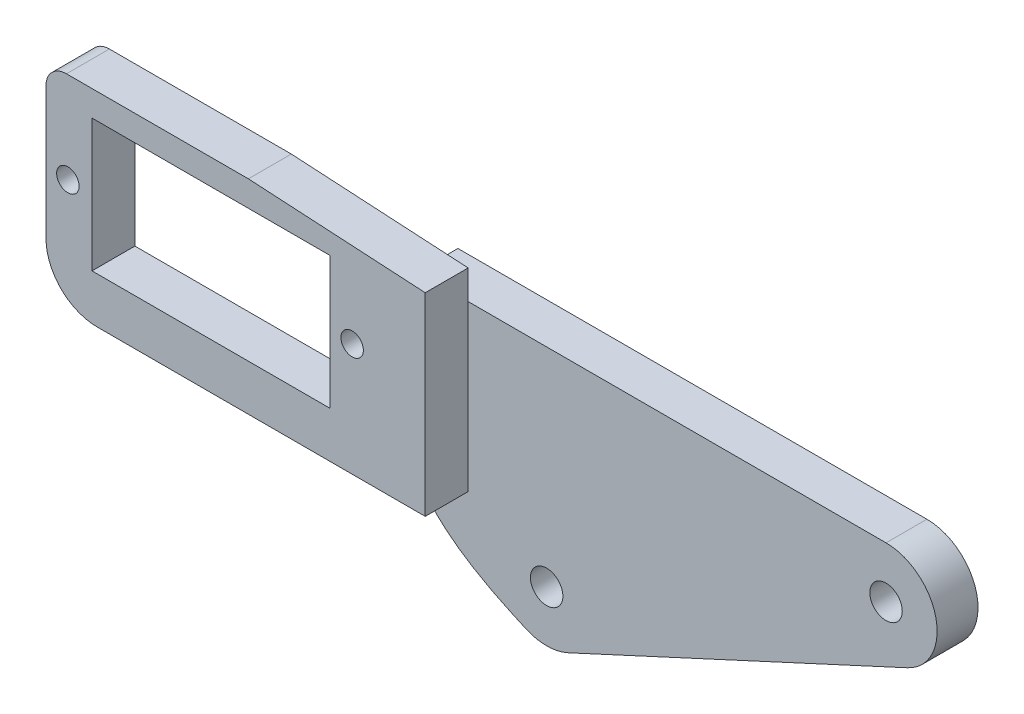
from build123d import *

# Parameters (mm, degrees)
BOSS_EXTRUDE1_DEPTH      = 2.5
BOSS_EXTRUDE1_DEPTH_BACK = 1.5
SKETCH2_R                = 1.5875
CUT_EXTRUDE1_DEPTH       = 44.756449915
CUT_EXTRUDE3_DEPTH       = 59.296841331
SKETCH4_W                = 4.2
SKETCH4_H                = 22.2
BOSS_EXTRUDE2_DEPTH      = 32.1
SKETCH6_W                = 23.3
SKETCH6_H                = 12.95
CUT_EXTRUDE4_DEPTH       = 4.2
SKETCH7_W                = 4.2
SKETCH7_H                = 22.2
BOSS_EXTRUDE3_DEPTH      = 5
CUT_EXTRUDE5_DEPTH       = 3.7
FILLET1_R                = 5
F_2_0MM_DOWEL_HOLE1_D    = 2.2
SKETCH12_W               = 37.1
SKETCH12_H               = 2.25
CUT_EXTRUDE6_DEPTH       = 4.2
FILLET3_R                = 2
CUT_EXTRUDE7_REACH       = 51.552


with BuildPart() as part:
    # Sketch1 → Boss-Extrude1 (new, two sides: drawn at the far end of the back side and taken through both)
    with BuildSketch(Plane.XY.offset(-BOSS_EXTRUDE1_DEPTH_BACK)):
        with BuildLine():
            Line((-33.54, 5), (33.54, 5))
            ThreePointArc((33.54, 5), (38.423518139, 1.072963462), (35.635934611, -4.539499764))
            Line((35.635934611, -4.539499764), (2.434033336, -19.869165506))
            ThreePointArc((2.434033336, -19.869165506), (0.357155817, -20.329629424), (-1.723171376, -19.885010467))
            Line((-1.723171376, -19.885010467), (-35.601270101, -4.555344726))
            ThreePointArc((-35.601270101, -4.555344726), (-38.42757218, 1.054342537), (-33.54, 5))
        make_face()
    extrude(amount=BOSS_EXTRUDE1_DEPTH + BOSS_EXTRUDE1_DEPTH_BACK)

    # Sketch2 → Cut-Extrude1 (cut, through all)
    with BuildSketch(Plane.XY.offset(2.5)):
        with Locations((-33.54, 0)):
            Circle(SKETCH2_R)
        with Locations((33.54, 0)):
            Circle(SKETCH2_R)
        with Locations((0.338098725, -15.329665742)):
            Circle(SKETCH2_R)
    extrude(amount=-CUT_EXTRUDE1_DEPTH, mode=Mode.SUBTRACT)

    # Sketch3 → Cut-Extrude3 (cut, through all)
    with BuildSketch(Plane.ZY.offset(16.04)):
        Polygon((-1.5, -4.555344726), (-1.5, -19.885010467), (2.5, -19.885010467), (2.5, -4.555344726), (2.5, 5), (-1.5, 5), align=None)
    extrude(amount=CUT_EXTRUDE3_DEPTH, mode=Mode.SUBTRACT)

    # Sketch4 → Boss-Extrude2 (add)
    with BuildSketch(Plane.ZY.offset(12.34)):
        with Locations((4.6, 0)):
            Rectangle(SKETCH4_W, SKETCH4_H)
    extrude(amount=BOSS_EXTRUDE2_DEPTH)

    # Sketch6 → Cut-Extrude4 (cut)
    with BuildSketch(Plane(origin=(0, 0, 2.5), x_dir=(-1, 0, 0), z_dir=(0, 0, -1))):
        with Locations((28.29, -0.125)):
            Rectangle(SKETCH6_W, SKETCH6_H)
    extrude(amount=-CUT_EXTRUDE4_DEPTH, mode=Mode.SUBTRACT)

    # Sketch7 → Boss-Extrude3 (add)
    with BuildSketch(Plane(origin=(-12.34, 0, 0), x_dir=(0, 0, -1), z_dir=(1, 0, 0))):
        with Locations((-4.6, 0)):
            Rectangle(SKETCH7_W, SKETCH7_H)
    extrude(amount=BOSS_EXTRUDE3_DEPTH)

    # Sketch8 → Cut-Extrude5 (cut)
    with BuildSketch(Plane.ZY.offset(12.34)):
        Polygon((2.5, -13.406719018), (2.5, -11.1), (2.5, 5), (-1.5, 5), (-1.5, -13.406719018), (-1.5, -19.885010467), (2.5, -19.885010467), align=None)
    extrude(amount=CUT_EXTRUDE5_DEPTH, mode=Mode.SUBTRACT)

    # Fillet1
    fillet1_edges = [part.edges().sort_by_distance(p)[0] for p in [
        (-44.44, -11.1, 4.6),
    ]]
    fillet(fillet1_edges, radius=FILLET1_R)

    # Fillet2
    # a fillet whose section is not a circle: 13, 9 mm, written as the material it takes off along each edge
    with BuildSketch(Plane(origin=(-12.34, -15.080950022, 2.5), x_dir=(0, 1, 0), z_dir=(0, 0, -1))) as fillet2_piece_1:
        with BuildLine():
            Bezier((3.996072697, 0), (0, 0), (-4.203547809, 9.289713818), weights=[1, 0.840313638, 1])
            Line((-4.203547809, 9.289713818), (0, 0))
            Line((0, 0), (3.996072697, 0))
        make_face()
    extrude(amount=29.491248131, mode=Mode.SUBTRACT)

    # Ø2.0mm Dowel Hole1 (through all)
    with Locations(Plane.XY.offset(6.7)):
        with Locations((-42.3, -0.06), (-14.49, -0.06)):
            Hole(F_2_0MM_DOWEL_HOLE1_D / 2)

    # Sketch12 → Cut-Extrude6 (cut)
    with BuildSketch(Plane.XY.offset(6.7)):
        with Locations((-25.89, 9.975)):
            Rectangle(SKETCH12_W, SKETCH12_H)
    extrude(amount=-CUT_EXTRUDE6_DEPTH, mode=Mode.SUBTRACT)

    # Fillet3
    fillet3_edges = [part.edges().sort_by_distance(p)[0] for p in [
        (-44.44, 8.85, 4.6),
    ]]
    fillet(fillet3_edges, radius=FILLET3_R)

    # Sketch13 → Cut-Extrude7 (cut, up to next)
    with BuildSketch(Plane.XY.offset(6.7), mode=Mode.PRIVATE) as cut_extrude7_sk1:
        Polygon((-7.34, 8.85), (-7.34, 7.85), (-24.64, 8.85), align=None)
    cut_extrude7_tool1 = extrude(cut_extrude7_sk1.sketch, amount=-CUT_EXTRUDE7_REACH, mode=Mode.PRIVATE) & part.part
    add(cut_extrude7_tool1.solids().sort_by_distance((-13.106667, 8.516667, 6.7))[0], mode=Mode.SUBTRACT)


solid = part.part
